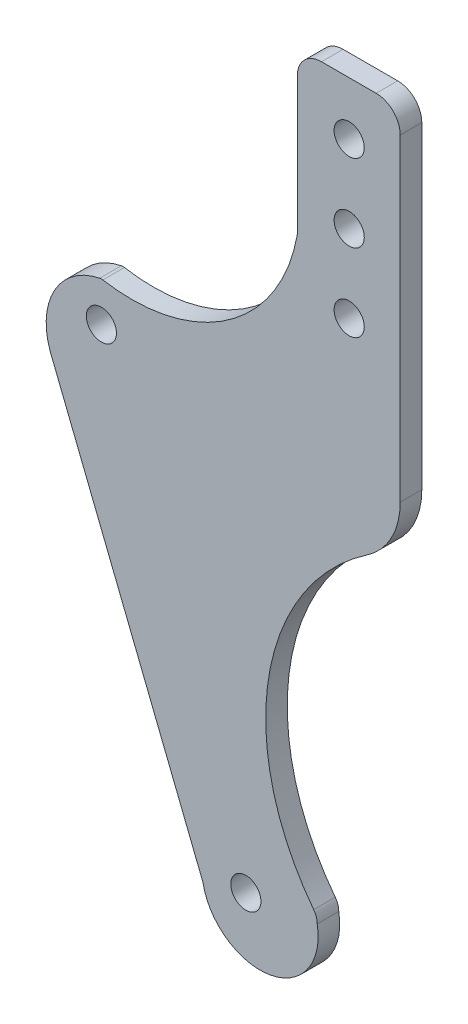
from build123d import *

# Parameters (mm, degrees)
SKETCH1_R           = 2.2225
BOSS_EXTRUDE1_DEPTH = 3.175


with BuildPart() as part:
    # Sketch1 → Boss-Extrude1 (new body)
    with BuildSketch(Plane.XY):
        with BuildLine():
            Line((-26.682968963, 26.357722587), (-26.682968963, 6.351785872))
            ThreePointArc((-26.682968963, 6.351785872), (-26.693527307, 6.120431356), (-26.725114563, 5.891000243))
            ThreePointArc((-26.725114563, 5.891000243), (-36.932915208, -9.945248539), (-55.328203965, -14.019474973))
            ThreePointArc((-55.328203965, -14.019474973), (-55.554473877, -14.001365453), (-55.780223055, -14.025100158))
            ThreePointArc((-55.780223055, -14.025100158), (-62.402560981, -18.816713415), (-63.103372405, -26.960654757))
            Line((-63.103372405, -26.960654757), (-40.595944625, -83.455943866))
            ThreePointArc((-40.595944625, -83.455943866), (-30.641352377, -90.339421853), (-23.75787439, -80.384829605))
            ThreePointArc((-23.75787439, -80.384829605), (-23.88583974, -79.549342433), (-24.280867854, -78.802103023))
            ThreePointArc((-24.280867854, -78.802103023), (-30.912062559, -52.492603109), (-16.357010265, -29.594721511))
            ThreePointArc((-16.357010265, -29.594721511), (-12.809669567, -25.627558214), (-11.528139151, -20.46231955))
            Line((-11.528139151, -20.46231955), (-11.528139151, 26.357722587))
            ThreePointArc((-11.528139151, 26.357722587), (-12.569667438, 28.872194301), (-15.084139151, 29.913722587))
            Line((-15.084139151, 29.913722587), (-23.126968963, 29.913722587))
            ThreePointArc((-23.126968963, 29.913722587), (-25.641440677, 28.872194301), (-26.682968963, 26.357722587))
        make_face()
        with Locations((-55.544078679, -19.824964902)):
            Circle(SKETCH1_R, mode=Mode.SUBTRACT)
        with Locations((-19.05, 22.084955235)):
            Circle(SKETCH1_R, mode=Mode.SUBTRACT)
        with Locations((-19.05, -0.775044765)):
            Circle(SKETCH1_R, mode=Mode.SUBTRACT)
        with Locations((-34.268702177, -81.651111456)):
            Circle(SKETCH1_R, mode=Mode.SUBTRACT)
        with Locations((-19.05, 10.654955235)):
            Circle(SKETCH1_R, mode=Mode.SUBTRACT)
    extrude(amount=BOSS_EXTRUDE1_DEPTH)


solid = part.part
